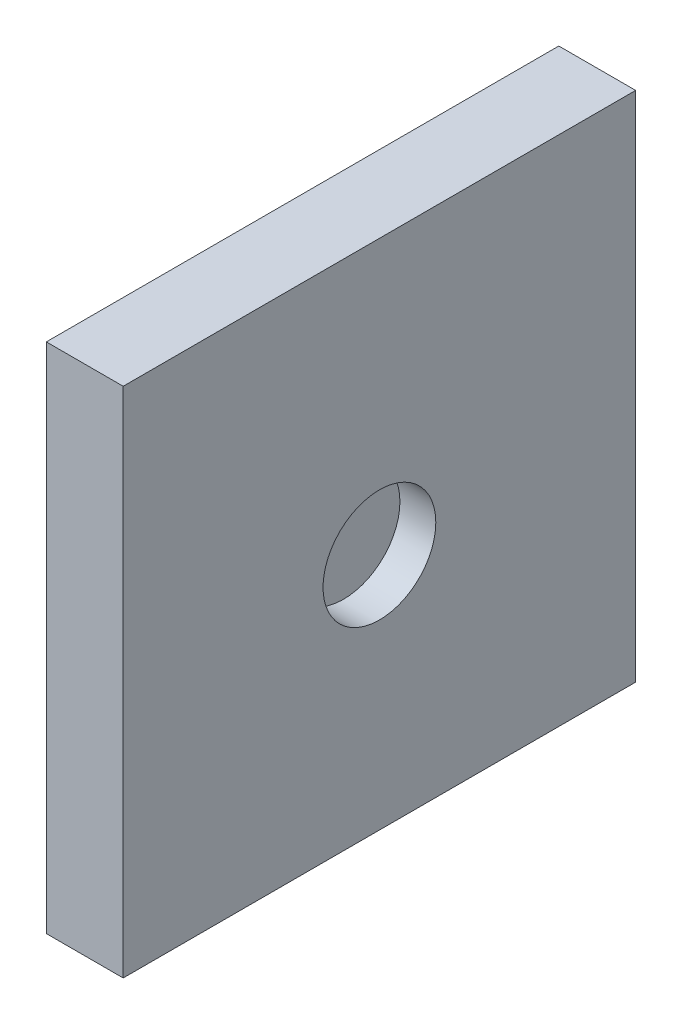
from build123d import *

# Parameters (mm, degrees)
CROQUIS1_W              = 100
CROQUIS1_H              = 100
SALIENTE_EXTRUIR1_DEPTH = 15
CROQUIS3_R              = 11
CORTAR_EXTRUIR1_DEPTH   = 7


with BuildPart() as part:
    # Croquis1 → Saliente-Extruir1 (new body)
    with BuildSketch(Plane(origin=(0, 0, 0), x_dir=(0, 0, -1), z_dir=(1, 0, 0))):
        Rectangle(CROQUIS1_W, CROQUIS1_H)
    extrude(amount=SALIENTE_EXTRUIR1_DEPTH)

    # Croquis3 → Cortar-Extruir1 (cut)
    with BuildSketch(Plane(origin=(15, 0, 0), x_dir=(0, 0, -1), z_dir=(1, 0, 0))):
        with Locations((0, -3.5)):
            Circle(CROQUIS3_R)
    extrude(amount=-CORTAR_EXTRUIR1_DEPTH, mode=Mode.SUBTRACT)


solid = part.part
